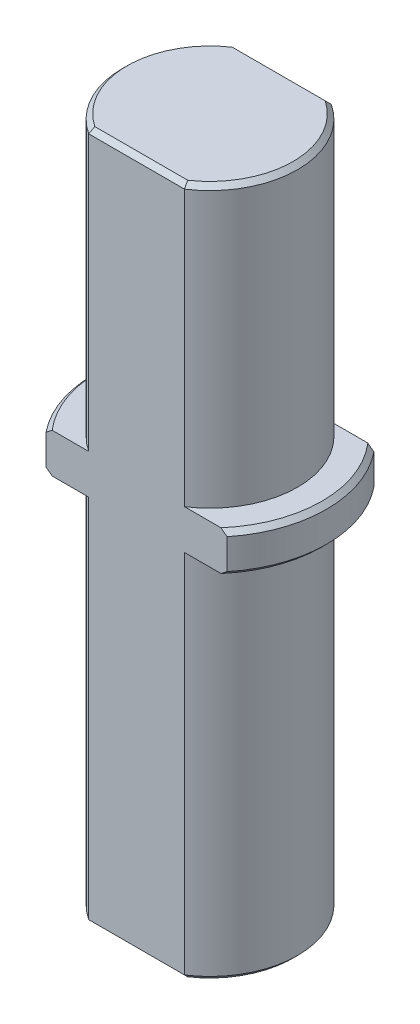
from build123d import *

# Parameters (mm, degrees)
BOSS_EXTRUDE1_DEPTH = 59.2
CHAMFER1_SIZE       = 0.4
BOSS_EXTRUDE2_DEPTH = 3.4
CHAMFER2_SIZE       = 0.4


with BuildPart() as part:
    # Sketch1 → Boss-Extrude1 (new body)
    with BuildSketch(Plane(origin=(0, 0, 0), x_dir=(1, 0, 0), z_dir=(0, 1, 0))):
        with BuildLine():
            ThreePointArc((-4.106141741, 6.3), (-7.52, 0), (-4.106141741, -6.3))
            Line((-4.106141741, -6.3), (4.106141741, -6.3))
            ThreePointArc((4.106141741, -6.3), (7.52, 0), (4.106141741, 6.3))
            Line((4.106141741, 6.3), (-4.106141741, 6.3))
        make_face()
    extrude(amount=BOSS_EXTRUDE1_DEPTH)

    # Chamfer1
    chamfer1_edges = [part.edges().sort_by_distance(p)[0] for p in [
        (0, 0, 6.3),
        (0, 59.2, 6.3),
        (0, 0, -6.3),
        (-7.52, 0, 0),
        (-7.52, 59.2, 0),
        (0, 59.2, -6.3),
        (7.52, 0, 0),
        (7.52, 59.2, 0),
    ]]
    chamfer(chamfer1_edges, length=CHAMFER1_SIZE)

    # Sketch2 → Boss-Extrude2 (add)
    with BuildSketch(Plane(origin=(0, 35.2, 0), x_dir=(1, 0, 0), z_dir=(0, 1, 0))):
        with BuildLine():
            Line((-7.765951326, -6.3), (7.765951326, -6.3))
            ThreePointArc((7.765951326, -6.3), (10, 0), (7.765951326, 6.3))
            Line((7.765951326, 6.3), (-7.765951326, 6.3))
            ThreePointArc((-7.765951326, 6.3), (-10, 0), (-7.765951326, -6.3))
        make_face()
    extrude(amount=-BOSS_EXTRUDE2_DEPTH)

    # Chamfer2
    chamfer2_edges = [part.edges().sort_by_distance(p)[0] for p in [
        (10, 31.8, 0),
        (10, 35.2, 0),
        (-10, 31.8, 0),
        (-10, 35.2, 0),
    ]]
    chamfer(chamfer2_edges, length=CHAMFER2_SIZE)


solid = part.part
